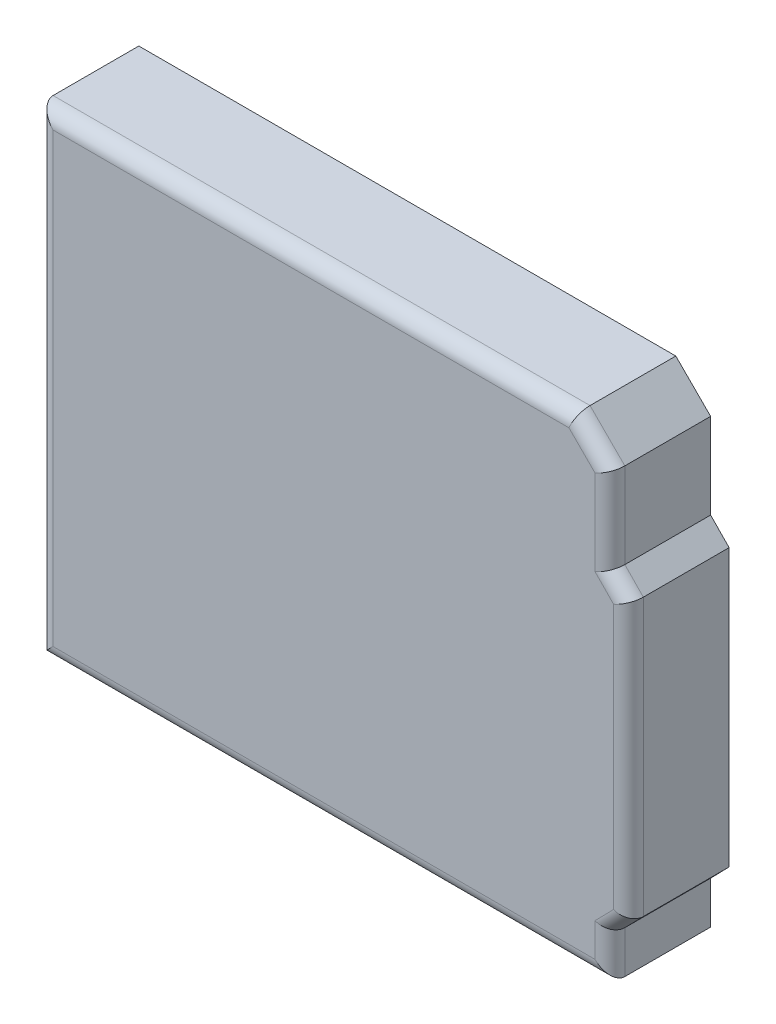
from build123d import *

# Parameters (mm, degrees)
BOSS_EXTRUDE1_DEPTH = 13.5
CUT_EXTRUDE1_DEPTH  = 8.5
FILLET2_R           = 2


with BuildPart() as part:
    # Sketch4 → Boss-Extrude1 (new body)
    with BuildSketch(Plane.XY):
        Polygon((-58.781454962, -20.879462681), (17.888545038, -20.879462681), (17.888545038, -15.197779921), (20.368545038, -12.657779921), (20.368545038, 24.42485456), (17.888545038, 26.96485456), (17.888545038, 38.4295492), (13.219086919, 43.099007319), (-58.781454962, 43.099007319), align=None)
    extrude(amount=BOSS_EXTRUDE1_DEPTH)

    # Sketch6 → Cut-Extrude1 (cut)
    with BuildSketch(Plane(origin=(0, 0, 0), x_dir=(-1, 0, 0), z_dir=(0, 0, -1))):
        Polygon((53.781454962, -15.879462681), (53.781454962, 38.099007319), (-11.148019107, 38.099007319), (-12.888545038, 36.358481388), (-12.888545038, 24.92870622), (-15.368545038, 22.38870622), (-15.368545038, -10.621631581), (-12.888545038, -13.161631581), (-12.888545038, -15.879462681), align=None)
    extrude(amount=-CUT_EXTRUDE1_DEPTH, mode=Mode.SUBTRACT)

    # Fillet2
    fillet2_edges = [part.edges().sort_by_distance(p)[0] for p in [
        (19.128545038, 25.69485456, 13.5),
        (17.888545038, 32.69720188, 13.5),
        (15.553815978, 40.76427826, 13.5),
        (-22.781184022, 43.099007319, 13.5),
        (-58.781454962, 11.109772319, 13.5),
        (-20.446454962, -20.879462681, 13.5),
        (17.888545038, -18.038621301, 13.5),
        (19.128545038, -13.927779921, 13.5),
        (20.368545038, 5.883537319, 13.5),
    ]]
    fillet(fillet2_edges, radius=FILLET2_R)


solid = part.part
